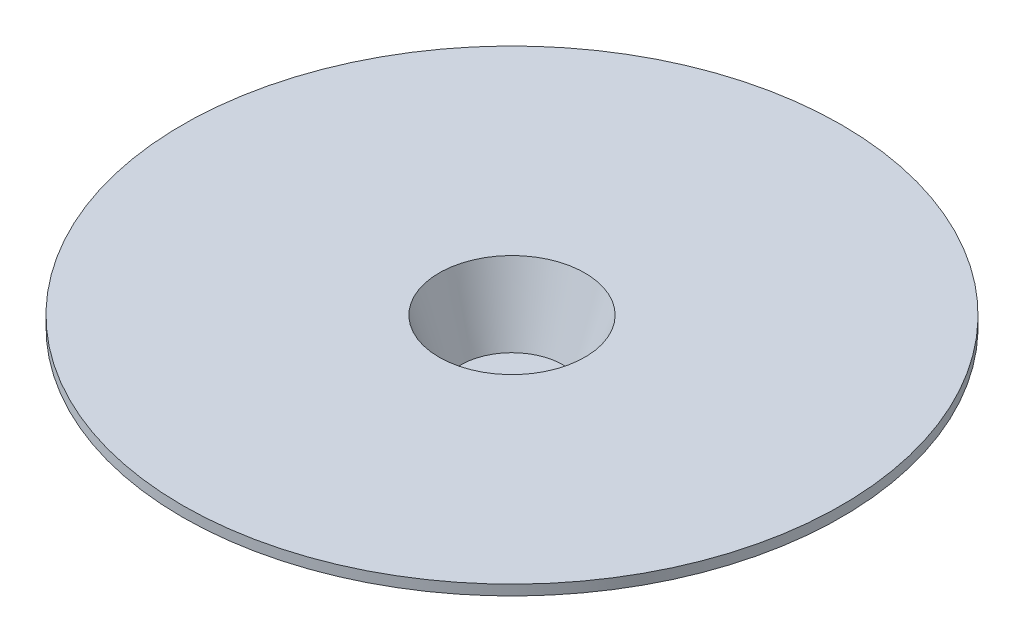
from build123d import *


with BuildPart() as part:
    # Sketch1 → Revolve2 (revolve)
    with BuildSketch(Plane.XY, mode=Mode.PRIVATE) as revolve2_sk:
        Polygon((0, -40.25), (0, -46.25), (55.5, -46.25), (55.5, -40.29713119), (36.117911549, -40.29713119), (46.896841146, -6), (192.649801929, -6), (192.649801929, 0), (42.649801929, 0), (30, -40.25), align=None)
    revolve(revolve2_sk.sketch.rotate(Axis((0, -40.25, 0), (0, -1, 0)), 90), axis=Axis((0, -40.25, 0), (0, -1, 0)))


solid = part.part
